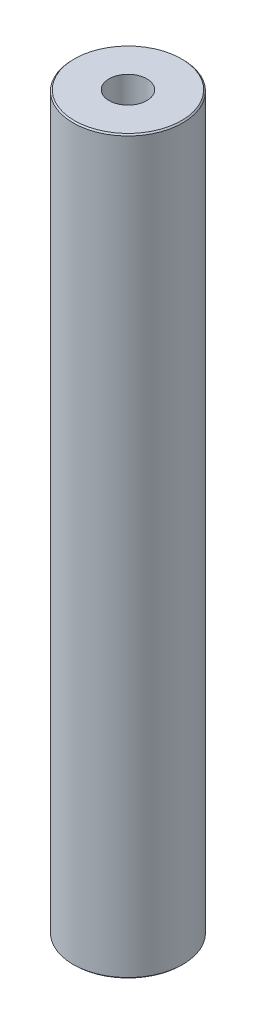
from build123d import *

# Parameters (mm, degrees)
SKETCH1_R           = 45
BOSS_EXTRUDE1_DEPTH = 600
SKETCH2_R           = 15.505874386
CUT_EXTRUDE1_DEPTH  = 604.365560834
CHAMFER1_SIZE       = 1.071082617


with BuildPart() as part:
    # Sketch1 → Boss-Extrude1 (new body)
    with BuildSketch(Plane(origin=(0, 0, 0), x_dir=(1, 0, 0), z_dir=(0, 1, 0))):
        Circle(SKETCH1_R)
    extrude(amount=BOSS_EXTRUDE1_DEPTH)

    # Sketch2 → Cut-Extrude1 (cut, through all)
    with BuildSketch(Plane(origin=(0, 0, 0), x_dir=(1, 0, 0), z_dir=(0, 1, 0))):
        Circle(SKETCH2_R)
    extrude(amount=CUT_EXTRUDE1_DEPTH, mode=Mode.SUBTRACT)

    # Chamfer1
    chamfer1_edges = [part.edges().sort_by_distance(p)[0] for p in [
        (-45, 600, 0),
        (-45, 0, 0),
    ]]
    chamfer(chamfer1_edges, length=CHAMFER1_SIZE)


solid = part.part
